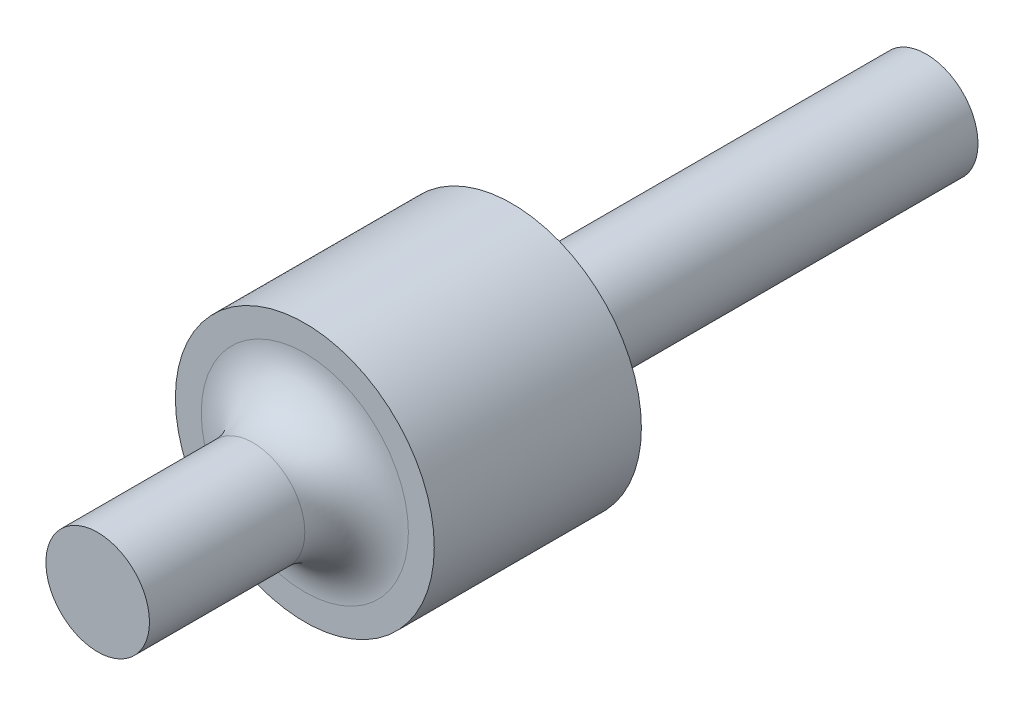
from build123d import *

# Parameters (mm, degrees)
SKETCH1_R           = 12.5
BOSS_EXTRUDE1_DEPTH = 10
SKETCH2_R           = 5
BOSS_EXTRUDE2_DEPTH = 20
BOSS_EXTRUDE3_START = 40
SKETCH3_R           = 5
BOSS_EXTRUDE3_DEPTH = 40
FILLET1_R           = 5


with BuildPart() as part:
    # Sketch1 → Boss-Extrude1 (new, symmetric)
    with BuildSketch(Plane.XY):
        Circle(SKETCH1_R)
    extrude(amount=BOSS_EXTRUDE1_DEPTH, both=True)

    # Sketch2 → Boss-Extrude2 (add)
    with BuildSketch(Plane.XY.offset(10)):
        Circle(SKETCH2_R)
    extrude(amount=BOSS_EXTRUDE2_DEPTH)

    # Sketch3 → Boss-Extrude3 (add)
    with BuildSketch(Plane(origin=(0, 0, -10), x_dir=(-1, 0, 0), z_dir=(0, 0, -1)).offset(BOSS_EXTRUDE3_START)):
        Circle(SKETCH3_R)
    extrude(amount=-BOSS_EXTRUDE3_DEPTH)

    # Fillet1
    fillet1_edges = [part.edges().sort_by_distance(p)[0] for p in [
        (-5, 0, 10),
        (5, 0, -10),
    ]]
    fillet(fillet1_edges, radius=FILLET1_R)


solid = part.part
